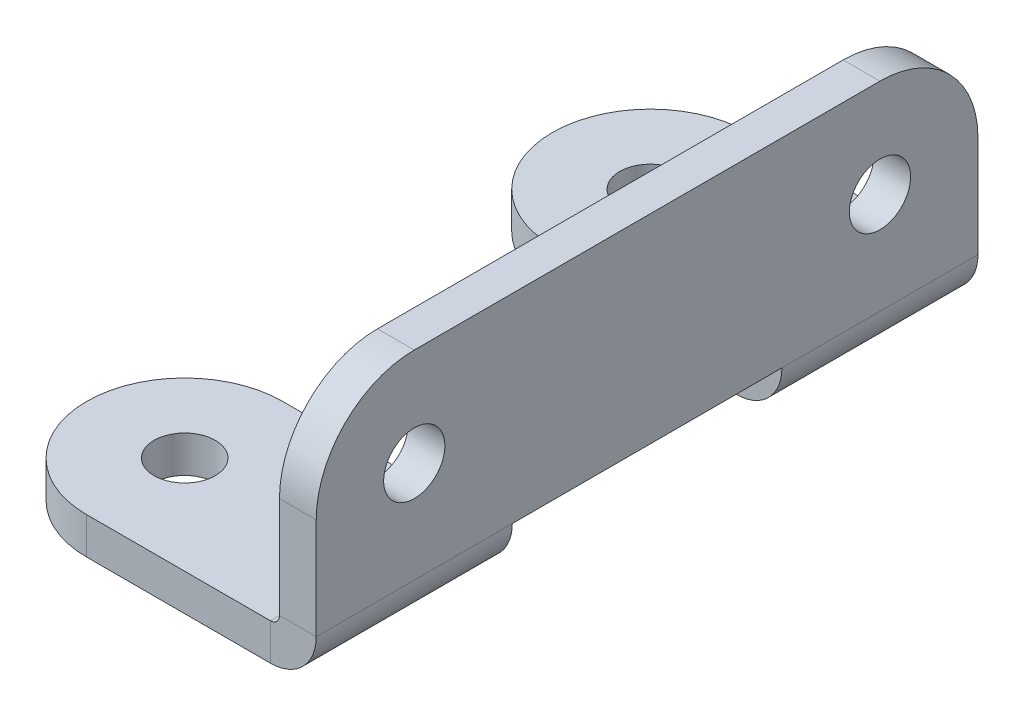
from build123d import *

# Parameters (mm, degrees)
SKETCH1_R          = 2.5
BASE_FLANGE1_DEPTH = 3
EDGE_FLANGE1_DEPTH = 16
SKETCH10_R         = 2.5
CUT_EXTRUDE1_DEPTH = 10
TAB1_START         = -3
TAB1_DEPTH         = 3


# Read off the part's stored shape, not the designer's step: Tab1
# Sheet-metal steps are written as plain solids
with BuildPart() as part:
    # Sketch1 → Base-Flange1 (new body)
    with BuildSketch(Plane(origin=(0, 0, 0), x_dir=(1, 0, 0), z_dir=(0, 1, 0))):
        with BuildLine():
            Line((15, -8), (0, -8))
            ThreePointArc((0, -8), (-8, 0), (0, 8))
            Line((0, 8), (15, 8))
            Line((15, 8), (15, -8))
        make_face()
        with Locations(Location((0, 0, 0), (0, 0, 270))):
            Circle(SKETCH1_R, mode=Mode.SUBTRACT)
    extrude(amount=-BASE_FLANGE1_DEPTH)

    # Edge-Flange1 section (across the edge) → Edge-Flange1 (add)
    with BuildSketch(Plane(origin=(15.7366, 0, 8), x_dir=(-1, 0, 0), z_dir=(0, 0, -1))):
        with BuildLine():
            Line((-3, 0.7366), (-3, 17))
            Line((-3, 17), (0, 17))
            Line((0, 17), (0, 0.7366))
            ThreePointArc((0, 0.7366), (0.215745145, 0.215745145), (0.7366, 0))
            Line((0.7366, 0), (0.7366, -3))
            ThreePointArc((0.7366, -3), (-1.905575199, -1.905575199), (-3, 0.7366))
        make_face()
    extrude(amount=EDGE_FLANGE1_DEPTH)

    # Sketch10 → Cut-Extrude1 (cut)
    with BuildSketch(Plane.ZY.offset(-15.7366)):
        with BuildLine():
            Line((-8, 17), (-8, 9))
            ThreePointArc((-8, 9), (-5.656854249, 14.656854249), (0, 17))
            Line((0, 17), (-8, 17))
        make_face()
        with BuildLine():
            Line((8, 17), (0, 17))
            ThreePointArc((0, 17), (5.656854249, 14.656854249), (8, 9))
            Line((8, 9), (8, 17))
        make_face()
        with Locations(Location((0, 9, 0), (0, 0, 270))):
            Circle(SKETCH10_R)
    extrude(amount=-CUT_EXTRUDE1_DEPTH, mode=Mode.SUBTRACT)


with BuildPart() as body_2:
    # Mirror1: mirrored copy
    add(part.part.mirror(Plane.XY.offset(-19)))


with BuildPart() as part_1:
    add(part.part)

    add(body_2.part)  # Tab1 merges body 2
    # Tab1 outline → Tab1 (add)
    with BuildSketch(Plane.ZY.offset(-15.7366).offset(TAB1_START)):
        with BuildLine():
            ThreePointArc((-8, 9), (-5.656854249, 14.656854249), (0, 17))
            Line((0, 17), (-38, 17))
            ThreePointArc((-38, 17), (-32.343145751, 14.656854249), (-30, 9))
            Line((-30, 9), (-30, 0.7366))
            Line((-30, 0.7366), (-8, 0.7366))
            Line((-8, 0.7366), (-8, 9))
        make_face()
    extrude(amount=TAB1_DEPTH)


solid = part_1.part
